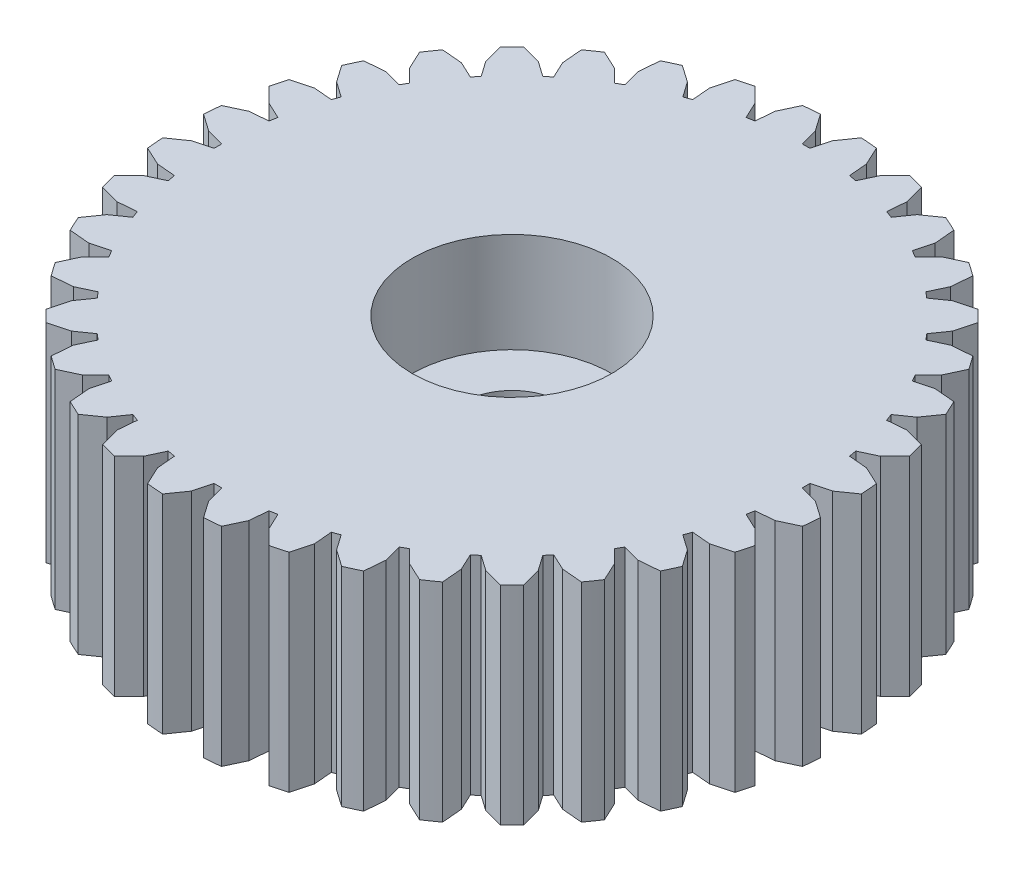
from build123d import *

# Parameters (mm, degrees)
SKETCH1_R           = 10.0584
BOSS_EXTRUDE1_DEPTH = 6.35
SKETCH2_R           = 1.524
CUT_EXTRUDE1_DEPTH  = 16.577718739
SKETCH3_R           = 3.048
CUT_EXTRUDE2_DEPTH  = 3.048
CUT_EXTRUDE3_DEPTH  = 16.577718739
CIRPATTERN1_COUNT   = 36


with BuildPart() as part:
    # Sketch1 → Boss-Extrude1 (new body)
    with BuildSketch(Plane(origin=(0, 0, 0), x_dir=(1, 0, 0), z_dir=(0, 1, 0))):
        Circle(SKETCH1_R)
    extrude(amount=BOSS_EXTRUDE1_DEPTH)

    # Sketch2 → Cut-Extrude1 (cut, through all)
    with BuildSketch(Plane(origin=(0, 6.35, 0), x_dir=(1, 0, 0), z_dir=(0, 1, 0))):
        Circle(SKETCH2_R)
    extrude(amount=-CUT_EXTRUDE1_DEPTH, mode=Mode.SUBTRACT)

    # Sketch3 → Cut-Extrude2 (cut)
    with BuildSketch(Plane(origin=(0, 6.35, 0), x_dir=(1, 0, 0), z_dir=(0, 1, 0))):
        Circle(SKETCH3_R)
    extrude(amount=-CUT_EXTRUDE2_DEPTH, mode=Mode.SUBTRACT)

    # Sketch4 → Cut-Extrude3 (cut, through all)
    with BuildSketch(Plane.XZ):
        Polygon((0.264583333, -9.525), (0.117669251, -8.976709182), (0.047227641, -8.976709182), (-0.117669251, -8.976709182), (-0.264583333, -9.525), (-0.7901481, -10.275584274), (0.772573957, -10.250485797), align=None)
    cut_extrude3 = extrude(amount=-CUT_EXTRUDE3_DEPTH, mode=Mode.SUBTRACT)

    # CirPattern1: Cut-Extrude3 ×36 about axis
    cirpattern1_axis = Axis((0, 0, 0), (0, 1, 0))
    for i in range(1, CIRPATTERN1_COUNT):
        add(cut_extrude3.rotate(cirpattern1_axis, i * 360 / CIRPATTERN1_COUNT), mode=Mode.SUBTRACT)


solid = part.part
